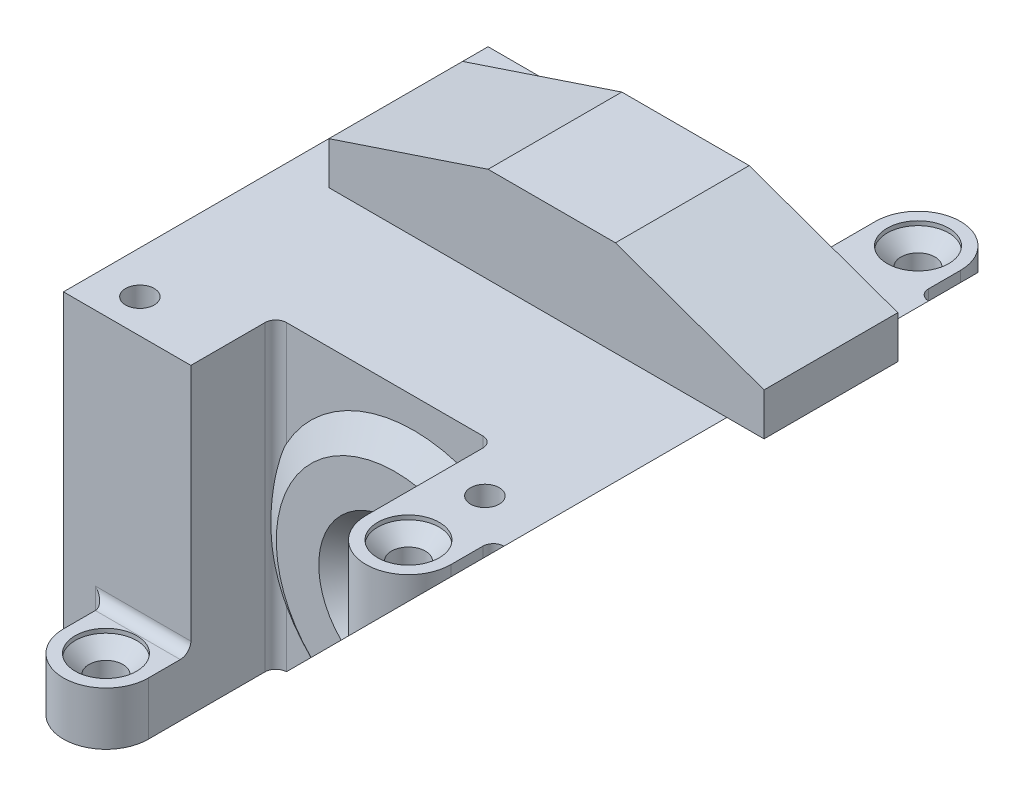
from build123d import *

# Parameters (mm, degrees)
BOSS_EXTRU_1_DEPTH                       = 28.5
ESQUISSE5_W                              = 45
ESQUISSE5_H                              = 12.6
BOSS_EXTRU_2_DEPTH                       = 9
ESQUISSE3_R                              = 24.1
ENL_V_MAT_EXTRU_3_DEPTH                  = 8
ENL_V_START                              = -12.6
ENL_V_MAT_EXTRU_5_DEPTH                  = 12.6
ENL_V_START_2                            = -1
ESQUISSE4_R                              = 24.1
ESQUISSE4_R_2                            = 8.05
ENL_V_MAT_EXTRU_4_DEPTH                  = 1
ENL_V_MAT_EXTRU_7_DEPTH                  = 161.796665884
ENL_V_MAT_EXTRU_7_DEPTH_BACK             = 161.796665884
ENL_V_START_3                            = -4
ESQUISSE8_R                              = 7.5
ENL_V_MAT_EXTRU_8_DEPTH                  = 26
ENL_V_START_4                            = 8
ESQUISSE9_R                              = 15
ENL_V_MAT_EXTRU_9_DEPTH                  = 10
ESQUISSE10_R                             = 15
ESQUISSE10_R_2                           = 8.05
ENL_V_MAT_EXTRU_10_DEPTH                 = 1
CONG_1_R                                 = 2
ESQUISSE11_W                             = 12
ESQUISSE11_H                             = 8
ENL_V_MAT_EXTRU_11_DEPTH                 = 23.5
CONG_2_R                                 = 1
FRAISAGE_POUR_VIS_T_TE_FRAIS_E_6_2_COUNT = 2
FRAISAGE_POUR_VIS_T_TE_FRAIS_E_6_2_PITCH = 48
ESQUISSE16_R                             = 1.35
ENL_V_MAT_EXTRU_12_DEPTH                 = 7
BOSS_EXTRU_4_START                       = 1.75
BOSS_EXTRU_4_DEPTH                       = 1.75
BOSS_EXTRU_5_DEPTH                       = 1.75
CHANFREIN2_ANGLE                         = 177.039506
CHANFREIN1_SIZE                          = 1.5


with BuildPart() as part:
    # Esquisse1 → Boss.-Extru.1 (new body)
    with BuildSketch(Plane(origin=(0, -156.353982231, 0), x_dir=(1, 0, 0), z_dir=(0, 1, 0))):
        with BuildLine():
            Line((16.5, -20), (16.5, 20))
            ThreePointArc((16.5, 20), (15.792893219, 20.292893219), (15.5, 21))
            Line((15.5, 21), (15.5, 24))
            ThreePointArc((15.5, 24), (11.5, 28), (7.5, 24))
            Line((7.5, 24), (7.5, 18.75))
            Line((7.5, 18.75), (7.5, 17))
            ThreePointArc((7.5, 17), (7.207106781, 16.292893219), (6.5, 16))
            Line((6.5, 16), (-12, 16))
            ThreePointArc((-12, 16), (-12.707106781, 16.292893219), (-13, 17))
            Line((-13, 17), (-13, 24))
            ThreePointArc((-13, 24), (-17, 28), (-21, 24))
            Line((-21, 24), (-21, 21))
            ThreePointArc((-21, 21), (-21.292893219, 20.292893219), (-22, 20))
            Line((-22, 20), (-25, 20))
            Line((-25, 20), (-25, -20))
            Line((-25, -20), (-22, -20))
            ThreePointArc((-22, -20), (-21.292893219, -20.292893219), (-21, -21))
            Line((-21, -21), (-21, -24))
            ThreePointArc((-21, -24), (-17, -28), (-13, -24))
            Line((-13, -24), (-13, -13))
            ThreePointArc((-13, -13), (-12.707106781, -12.292893219), (-12, -12))
            Line((-12, -12), (6.5, -12))
            ThreePointArc((6.5, -12), (7.207106781, -12.292893219), (7.5, -13))
            Line((7.5, -13), (7.5, -24))
            ThreePointArc((7.5, -24), (11.5, -28), (15.5, -24))
            Line((15.5, -24), (15.5, -21))
            ThreePointArc((15.5, -21), (15.792893219, -20.292893219), (16.5, -20))
        make_face()
    extrude(amount=BOSS_EXTRU_1_DEPTH)

    # Esquisse5 → Boss.-Extru.2 (add)
    with BuildSketch(Plane(origin=(0, -127.853982231, 0), x_dir=(1, 0, 0), z_dir=(0, 1, 0))):
        with Locations((-2.5, 7.3)):
            Rectangle(ESQUISSE5_W, ESQUISSE5_H)
    extrude(amount=BOSS_EXTRU_2_DEPTH)

    # Esquisse3 → Enlèv. mat.-Extru.3 (cut)
    with BuildSketch(Plane(origin=(0, -128.853982231, -11), x_dir=(1, 0, 0), z_dir=(0, 0, 1))):
        with Locations((0, -15.5)):
            Circle(ESQUISSE3_R)
    extrude(amount=ENL_V_MAT_EXTRU_3_DEPTH, mode=Mode.SUBTRACT)

    # Esquisse6 → Enlèv. mat.-Extru.5 (cut)
    with BuildSketch(Plane.XY.offset(-1).offset(ENL_V_START)):
        Polygon((-25, -104.147876216), (-25, -127.853982231), (-21, -127.853982231), (-21, -123.853982231), (-6, -118.853982231), (6, -118.853982231), (20, -123.853982231), (20, -104.147876216), align=None)
    extrude(amount=ENL_V_MAT_EXTRU_5_DEPTH, mode=Mode.SUBTRACT)

    # Esquisse4 → Enlèv. mat.-Extru.4 (cut)
    with BuildSketch(Plane(origin=(0, -168.853982231, -11), x_dir=(1, 0, 0), z_dir=(0, 0, 1)).offset(ENL_V_START_2)):
        with Locations((0, 24.5)):
            Circle(ESQUISSE4_R)
        with Locations((0, 24.5)):
            Circle(ESQUISSE4_R_2, mode=Mode.SUBTRACT)
    extrude(amount=ENL_V_MAT_EXTRU_4_DEPTH, mode=Mode.SUBTRACT)

    # Esquisse7 → Enlèv. mat.-Extru.7 (cut, two sides: drawn at the far end of the back side and taken through both)
    with BuildSketch(Plane.XY.offset(-ENL_V_MAT_EXTRU_7_DEPTH_BACK)):
        with BuildLine():
            Line((-4.030508653, -148.384490884), (-12, -156.353982231))
            Line((-12, -156.353982231), (16.5, -156.353982231))
            Line((16.5, -156.353982231), (16.5, -127.853982231))
            Line((16.5, -127.853982231), (4.030508653, -140.323473578))
            ThreePointArc((4.030508653, -140.323473578), (-4.030508653, -140.323473578), (-4.030508653, -148.384490884))
        make_face()
    extrude(amount=ENL_V_MAT_EXTRU_7_DEPTH + ENL_V_MAT_EXTRU_7_DEPTH_BACK, mode=Mode.SUBTRACT)

    # Esquisse8 → Enlèv. mat.-Extru.8 (cut)
    with BuildSketch(Plane.XY.offset(-11).offset(ENL_V_START_3)):
        with Locations((0, -144.353982231)):
            Circle(ESQUISSE8_R)
    extrude(amount=ENL_V_MAT_EXTRU_8_DEPTH, mode=Mode.SUBTRACT)

    # Esquisse9 → Enlèv. mat.-Extru.9 (cut)
    with BuildSketch(Plane.XY.offset(-11).offset(ENL_V_START_4)):
        with Locations((0, -144.353982231)):
            Circle(ESQUISSE9_R)
    extrude(amount=ENL_V_MAT_EXTRU_9_DEPTH, mode=Mode.SUBTRACT)

    # Esquisse10 → Enlèv. mat.-Extru.10 (cut)
    with BuildSketch(Plane(origin=(0, 0, 7), x_dir=(-1, 0, 0), z_dir=(0, 0, -1)).offset(ENL_V_START_2)):
        with Locations((0, -144.353982231)):
            Circle(ESQUISSE10_R)
        with Locations((0, -144.353982231)):
            Circle(ESQUISSE10_R_2, mode=Mode.SUBTRACT)
    extrude(amount=ENL_V_MAT_EXTRU_10_DEPTH, mode=Mode.SUBTRACT)

    # Congé1
    # the kernel refuses this fillet: 2 mm, written as the material it adds along each edge
    with BuildSketch(Plane(origin=(0, -144.353982231, -12), x_dir=(0.7071067811865527, 0.7071067811865425, 0), z_dir=(0.7071067811865425, -0.7071067811865527, 0))) as cong_1_piece_1:
        with BuildLine():
            CenterArc((9.782050808, 2), CONG_1_R, 210, 60)
            Line((9.782050808, 0), (8.05, 0))
            Line((8.05, 0), (8.05, 1))
        make_face()
    revolve(axis=Axis((0, -144.353982231, -12), (0, 0, 1)), revolution_arc=180)
    with BuildSketch(Plane(origin=(0, -144.353982231, 8), x_dir=(0.7071067811865495, 0.7071067811865456, 0), z_dir=(0.7071067811865456, -0.7071067811865495, 0))) as cong_1_piece_2:
        with BuildLine():
            CenterArc((9.782050808, -2), CONG_1_R, 90, 60)
            Line((8.05, -1), (8.05, 0))
            Line((8.05, 0), (9.782050808, 0))
        make_face()
    revolve(axis=Axis((0, -144.353982231, 8), (0, 0, 1)), revolution_arc=180)
    # the kernel refuses this fillet: 2 mm, written as the material it takes off along each edge
    with BuildSketch(Plane(origin=(0, -144.353982231, -3), x_dir=(0.8997810894111481, 0.43634159913774845, 0), z_dir=(0.43634159913774845, -0.8997810894111481, 0))) as cong_1_2_piece_1:
        with BuildLine():
            CenterArc((15 + CONG_1_R, CONG_1_R), CONG_1_R, 180, 90)
            Line((15 + CONG_1_R, 0), (15, 0))
            Line((15, 0), (15, CONG_1_R))
        make_face()
    revolve(axis=Axis((0, -144.353982231, -3), (0, 0, 1)), revolution_arc=218.25861464, mode=Mode.SUBTRACT)

    # Esquisse11 → Enlèv. mat.-Extru.11 (cut)
    with BuildSketch(Plane(origin=(0, -127.853982231, 0), x_dir=(1, 0, 0), z_dir=(0, 1, 0))):
        with Locations((-19, 24)):
            Rectangle(ESQUISSE11_W, ESQUISSE11_H)
        with Locations((-19, -24)):
            Rectangle(ESQUISSE11_W, ESQUISSE11_H)
    extrude(amount=-ENL_V_MAT_EXTRU_11_DEPTH, mode=Mode.SUBTRACT)

    # Congé2
    cong_2_edges = [part.edges().sort_by_distance(p)[0] for p in [
        (-17.5, -151.353982231, -20),
        (-17.5, -151.353982231, 20),
    ]]
    fillet(cong_2_edges, radius=CONG_2_R)

    # Esquisse12 → Fraisage pour vis _ t_te frais_e _ 6 pan (revolve, cut)
    with BuildSketch(Plane(origin=(-17, -151.353982231, -24), x_dir=(0, 0, 1), z_dir=(1, 0, 0))):
        Polygon((0, 0), (0, 5), (1.6, 5), (1.6, 1.7), (2.9, 0.4), (2.9, 0), align=None)
    fraisage_pour_vis_t_te_frais_e_6_pan = revolve(axis=Axis((-17, -145.003982231, -24), (0, -1, 0)), mode=Mode.SUBTRACT)

    # Fraisage pour vis _ t_te frais_e _ 6 2: Fraisage pour vis _ t_te frais_e _ 6 pan ×2
    with Locations(*[(0, 0, i * FRAISAGE_POUR_VIS_T_TE_FRAIS_E_6_2_PITCH) for i in range(1, FRAISAGE_POUR_VIS_T_TE_FRAIS_E_6_2_COUNT)]):
        add(fraisage_pour_vis_t_te_frais_e_6_pan, mode=Mode.SUBTRACT)

    # Fraisage pour vis _ t_te frais_e _ 6 3: read off the stored shape, not the designer's step
    # Fraisage pour vis _ t_te frais_e _ 6 3 o → Fraisage pour vis _ t_te frais_e _ 6 3 (revolve, cut)
    with BuildSketch(Plane(origin=(11.5, 0, 24), x_dir=(1, 0, 0), z_dir=(0, 0, 1))):
        Polygon((0, -134.475881673), (1.6, -134.475881673), (1.6, -129.553982231), (2.9, -128.253982231), (2.9, -127.853982231), (0, -127.853982231), align=None)
    revolve(axis=Axis((11.5, 0, 24), (0, 1, 0)), mode=Mode.SUBTRACT)

    # Fraisage pour vis _ t_te frais_e _ 6 4 → Fraisage pour vis _ t_te frais_e _ 6 3 2 (revolve, cut)
    with BuildSketch(Plane(origin=(11.5, 0, -24), x_dir=(1, 0, 0), z_dir=(0, 0, 1))):
        Polygon((0, -134.475881673), (1.6, -134.475881673), (1.6, -129.553982231), (2.9, -128.253982231), (2.9, -127.853982231), (0, -127.853982231), align=None)
    revolve(axis=Axis((11.5, 0, -24), (0, 1, 0)), mode=Mode.SUBTRACT)

    # Esquisse16 → Enlèv. mat.-Extru.12 (cut)
    with BuildSketch(Plane(origin=(0, -127.853982231, 0), x_dir=(1, 0, 0), z_dir=(0, 1, 0))):
        with Locations(Location((-21, 16.8, 0), (0, 0, 180))):
            Circle(ESQUISSE16_R)
        with Locations(Location((11.5, 16.8, 0), (0, 0, 180))):
            Circle(ESQUISSE16_R)
        with Locations((11.5, -16.8)):
            Circle(ESQUISSE16_R)
        with Locations((-21, -16.8)):
            Circle(ESQUISSE16_R)
    extrude(amount=-ENL_V_MAT_EXTRU_12_DEPTH, mode=Mode.SUBTRACT)

    # Esquisse17 → Boss.-Extru.4 (add)
    with BuildSketch(Plane(origin=(0, 0, -16), x_dir=(-1, 0, 0), z_dir=(0, 0, -1)).offset(BOSS_EXTRU_4_START)):
        with BuildLine():
            Line((-4.030508653, -140.323473578), (-7.919595949, -136.434386282))
            ThreePointArc((-7.919595949, -136.434386282), (7.919595949, -136.434386282), (7.919595949, -152.27357818))
            Line((7.919595949, -152.27357818), (4.030508653, -148.384490884))
            ThreePointArc((4.030508653, -148.384490884), (4.030508653, -140.323473578), (-4.030508653, -140.323473578))
        make_face()
    extrude(amount=-BOSS_EXTRU_4_DEPTH)

    # Esquisse18 → Boss.-Extru.5 (add)
    with BuildSketch(Plane.XY.offset(12)):
        with BuildLine():
            Line((7.919595949, -136.434386282), (4.030508653, -140.323473578))
            ThreePointArc((4.030508653, -140.323473578), (-4.030508653, -140.323473578), (-4.030508653, -148.384490884))
            Line((-4.030508653, -148.384490884), (-7.919595949, -152.27357818))
            ThreePointArc((-7.919595949, -152.27357818), (-7.919595949, -136.434386282), (7.919595949, -136.434386282))
        make_face()
    extrude(amount=BOSS_EXTRU_5_DEPTH)

    # Chanfrein2: read off the stored shape, not the designer's step
    # Chanfrein2 outline → Chanfrein2 (revolve)
    with BuildSketch(Plane(origin=(0, -144.353982231, 0), x_dir=(0.66964285714286, 0.742683272921605, 0), z_dir=(0.742683272921605, -0.66964285714286, 0))):
        Polygon((13.7, 12), (11.2, 13.75), (11.2, 12), align=None)
        Polygon((11.2, -17.75), (13.7, -16), (11.2, -16), align=None)
    revolve(axis=Axis((0, -144.353982231, 0), (0, 0, 1)), revolution_arc=CHANFREIN2_ANGLE)

    # Chanfrein1
    chanfrein1_edges = [part.edges().sort_by_distance(p)[0] for p in [
        (-4.030508653, -140.323473578, -17.75),
        (-4.030508653, -140.323473578, 13.75),
    ]]
    chamfer(chanfrein1_edges, length=CHANFREIN1_SIZE)


solid = part.part
